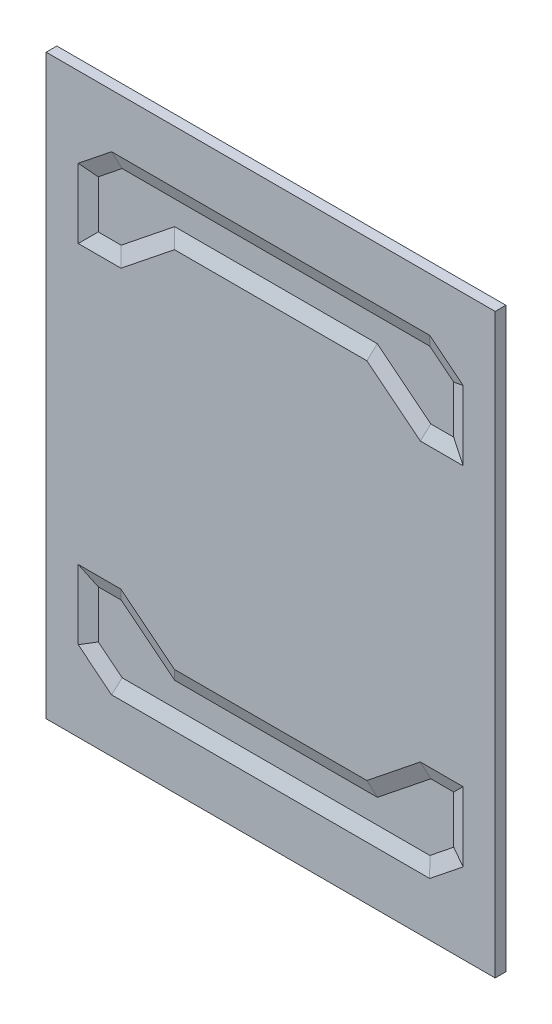
from build123d import *
from OCP.BRepFilletAPI import BRepFilletAPI_MakeChamfer

# Parameters (mm, degrees)
ESQUISSE1_W             = 420
ESQUISSE1_H             = 540
BOSS_EXTRU_1_DEPTH      = 10
ENL_V_MAT_EXTRU_1_DEPTH = 5
CHANFREIN1_SIZE         = 5
CHANFREIN1_SIZE_2       = 13.737387097


with BuildPart() as part:
    # Esquisse1 → Boss.-Extru.1 (new body)
    with BuildSketch(Plane.XY):
        with Locations((210, 270)):
            Rectangle(ESQUISSE1_W, ESQUISSE1_H)
    extrude(amount=BOSS_EXTRU_1_DEPTH)

    # Esquisse2 → Enlèv. mat.-Extru.1 (cut)
    with BuildSketch(Plane.XY.offset(10)):
        Polygon((300, 100), (120, 100), (70, 140), (30, 140), (30, 75), (61.25, 50), (358.75, 50), (390, 75), (390, 140), (350, 140), align=None)
        Polygon((30, 465), (61.25, 490), (358.75, 490), (390, 465), (390, 400), (350, 400), (300, 440), (120, 440), (70, 400), (30, 400), align=None)
    extrude(amount=-ENL_V_MAT_EXTRU_1_DEPTH, mode=Mode.SUBTRACT)

    # Chanfrein1
    chanfrein1_edges_1 = [part.edges().sort_by_distance(p)[0] for p in [
        (390, 107.5, 5),
    ]]
    chanfrein1_side_1 = [part.faces().sort_by_distance(p)[0] for p in [
        (390, 107.5, 5.1),
    ]]
    chanfrein1_edges_2 = [part.edges().sort_by_distance(p)[0] for p in [
        (374.375, 62.5, 5),
    ]]
    chanfrein1_side_2 = [part.faces().sort_by_distance(p)[0] for p in [
        (374.375, 62.5, 5.1),
    ]]
    chanfrein1_edges_3 = [part.edges().sort_by_distance(p)[0] for p in [
        (210, 50, 5),
    ]]
    chanfrein1_side_3 = [part.faces().sort_by_distance(p)[0] for p in [
        (210, 50, 5.1),
    ]]
    chanfrein1_edges_4 = [part.edges().sort_by_distance(p)[0] for p in [
        (45.625, 62.5, 5),
    ]]
    chanfrein1_side_4 = [part.faces().sort_by_distance(p)[0] for p in [
        (45.625, 62.5, 5.1),
    ]]
    chanfrein1_edges_5 = [part.edges().sort_by_distance(p)[0] for p in [
        (30, 107.5, 5),
    ]]
    chanfrein1_side_5 = [part.faces().sort_by_distance(p)[0] for p in [
        (30, 107.5, 5.1),
    ]]
    chanfrein1_edges_6 = [part.edges().sort_by_distance(p)[0] for p in [
        (50, 140, 5),
    ]]
    chanfrein1_side_6 = [part.faces().sort_by_distance(p)[0] for p in [
        (50, 140, 5.1),
    ]]
    chanfrein1_edges_7 = [part.edges().sort_by_distance(p)[0] for p in [
        (95, 120, 5),
    ]]
    chanfrein1_side_7 = [part.faces().sort_by_distance(p)[0] for p in [
        (95, 120, 5.1),
    ]]
    chanfrein1_edges_8 = [part.edges().sort_by_distance(p)[0] for p in [
        (210, 100, 5),
    ]]
    chanfrein1_side_8 = [part.faces().sort_by_distance(p)[0] for p in [
        (210, 100, 5.1),
    ]]
    chanfrein1_edges_9 = [part.edges().sort_by_distance(p)[0] for p in [
        (325, 120, 5),
    ]]
    chanfrein1_side_9 = [part.faces().sort_by_distance(p)[0] for p in [
        (325, 120, 5.1),
    ]]
    chanfrein1_edges_10 = [part.edges().sort_by_distance(p)[0] for p in [
        (370, 140, 5),
    ]]
    chanfrein1_side_10 = [part.faces().sort_by_distance(p)[0] for p in [
        (370, 140, 5.1),
    ]]
    chanfrein1_edges_11 = [part.edges().sort_by_distance(p)[0] for p in [
        (45.625, 477.5, 5),
    ]]
    chanfrein1_side_11 = [part.faces().sort_by_distance(p)[0] for p in [
        (45.625, 477.5, 5.1),
    ]]
    chanfrein1_edges_12 = [part.edges().sort_by_distance(p)[0] for p in [
        (210, 490, 5),
    ]]
    chanfrein1_side_12 = [part.faces().sort_by_distance(p)[0] for p in [
        (210, 490, 5.1),
    ]]
    chanfrein1_edges_13 = [part.edges().sort_by_distance(p)[0] for p in [
        (374.375, 477.5, 5),
    ]]
    chanfrein1_side_13 = [part.faces().sort_by_distance(p)[0] for p in [
        (374.375, 477.5, 5.1),
    ]]
    chanfrein1_edges_14 = [part.edges().sort_by_distance(p)[0] for p in [
        (390, 432.5, 5),
    ]]
    chanfrein1_side_14 = [part.faces().sort_by_distance(p)[0] for p in [
        (390, 432.5, 5.1),
    ]]
    chanfrein1_edges_15 = [part.edges().sort_by_distance(p)[0] for p in [
        (370, 400, 5),
    ]]
    chanfrein1_side_15 = [part.faces().sort_by_distance(p)[0] for p in [
        (370, 400, 5.1),
    ]]
    chanfrein1_edges_16 = [part.edges().sort_by_distance(p)[0] for p in [
        (325, 420, 5),
    ]]
    chanfrein1_side_16 = [part.faces().sort_by_distance(p)[0] for p in [
        (325, 420, 5.1),
    ]]
    chanfrein1_edges_17 = [part.edges().sort_by_distance(p)[0] for p in [
        (210, 440, 5),
    ]]
    chanfrein1_side_17 = [part.faces().sort_by_distance(p)[0] for p in [
        (210, 440, 5.1),
    ]]
    chanfrein1_edges_18 = [part.edges().sort_by_distance(p)[0] for p in [
        (95, 420, 5),
    ]]
    chanfrein1_side_18 = [part.faces().sort_by_distance(p)[0] for p in [
        (95, 420, 5.1),
    ]]
    chanfrein1_edges_19 = [part.edges().sort_by_distance(p)[0] for p in [
        (50, 400, 5),
    ]]
    chanfrein1_side_19 = [part.faces().sort_by_distance(p)[0] for p in [
        (50, 400, 5.1),
    ]]
    chanfrein1_edges_20 = [part.edges().sort_by_distance(p)[0] for p in [
        (30, 432.5, 5),
    ]]
    chanfrein1_side_20 = [part.faces().sort_by_distance(p)[0] for p in [
        (30, 432.5, 5.1),
    ]]
    chanfrein1 = BRepFilletAPI_MakeChamfer(part.part.solid().wrapped)
    for e in chanfrein1_edges_1:
        chanfrein1.Add(CHANFREIN1_SIZE - 0.0001, CHANFREIN1_SIZE_2 - 0.0001, e.wrapped, chanfrein1_side_1[0].wrapped)
    for e in chanfrein1_edges_2:
        chanfrein1.Add(CHANFREIN1_SIZE - 0.0001, CHANFREIN1_SIZE_2 - 0.0001, e.wrapped, chanfrein1_side_2[0].wrapped)
    for e in chanfrein1_edges_3:
        chanfrein1.Add(CHANFREIN1_SIZE - 0.0001, CHANFREIN1_SIZE_2 - 0.0001, e.wrapped, chanfrein1_side_3[0].wrapped)
    for e in chanfrein1_edges_4:
        chanfrein1.Add(CHANFREIN1_SIZE - 0.0001, CHANFREIN1_SIZE_2 - 0.0001, e.wrapped, chanfrein1_side_4[0].wrapped)
    for e in chanfrein1_edges_5:
        chanfrein1.Add(CHANFREIN1_SIZE - 0.0001, CHANFREIN1_SIZE_2 - 0.0001, e.wrapped, chanfrein1_side_5[0].wrapped)
    for e in chanfrein1_edges_6:
        chanfrein1.Add(CHANFREIN1_SIZE - 0.0001, CHANFREIN1_SIZE_2 - 0.0001, e.wrapped, chanfrein1_side_6[0].wrapped)
    for e in chanfrein1_edges_7:
        chanfrein1.Add(CHANFREIN1_SIZE - 0.0001, CHANFREIN1_SIZE_2 - 0.0001, e.wrapped, chanfrein1_side_7[0].wrapped)
    for e in chanfrein1_edges_8:
        chanfrein1.Add(CHANFREIN1_SIZE - 0.0001, CHANFREIN1_SIZE_2 - 0.0001, e.wrapped, chanfrein1_side_8[0].wrapped)
    for e in chanfrein1_edges_9:
        chanfrein1.Add(CHANFREIN1_SIZE - 0.0001, CHANFREIN1_SIZE_2 - 0.0001, e.wrapped, chanfrein1_side_9[0].wrapped)
    for e in chanfrein1_edges_10:
        chanfrein1.Add(CHANFREIN1_SIZE - 0.0001, CHANFREIN1_SIZE_2 - 0.0001, e.wrapped, chanfrein1_side_10[0].wrapped)
    for e in chanfrein1_edges_11:
        chanfrein1.Add(CHANFREIN1_SIZE - 0.0001, CHANFREIN1_SIZE_2 - 0.0001, e.wrapped, chanfrein1_side_11[0].wrapped)
    for e in chanfrein1_edges_12:
        chanfrein1.Add(CHANFREIN1_SIZE - 0.0001, CHANFREIN1_SIZE_2 - 0.0001, e.wrapped, chanfrein1_side_12[0].wrapped)
    for e in chanfrein1_edges_13:
        chanfrein1.Add(CHANFREIN1_SIZE - 0.0001, CHANFREIN1_SIZE_2 - 0.0001, e.wrapped, chanfrein1_side_13[0].wrapped)
    for e in chanfrein1_edges_14:
        chanfrein1.Add(CHANFREIN1_SIZE - 0.0001, CHANFREIN1_SIZE_2 - 0.0001, e.wrapped, chanfrein1_side_14[0].wrapped)
    for e in chanfrein1_edges_15:
        chanfrein1.Add(CHANFREIN1_SIZE - 0.0001, CHANFREIN1_SIZE_2 - 0.0001, e.wrapped, chanfrein1_side_15[0].wrapped)
    for e in chanfrein1_edges_16:
        chanfrein1.Add(CHANFREIN1_SIZE - 0.0001, CHANFREIN1_SIZE_2 - 0.0001, e.wrapped, chanfrein1_side_16[0].wrapped)
    for e in chanfrein1_edges_17:
        chanfrein1.Add(CHANFREIN1_SIZE - 0.0001, CHANFREIN1_SIZE_2 - 0.0001, e.wrapped, chanfrein1_side_17[0].wrapped)
    for e in chanfrein1_edges_18:
        chanfrein1.Add(CHANFREIN1_SIZE - 0.0001, CHANFREIN1_SIZE_2 - 0.0001, e.wrapped, chanfrein1_side_18[0].wrapped)
    for e in chanfrein1_edges_19:
        chanfrein1.Add(CHANFREIN1_SIZE - 0.0001, CHANFREIN1_SIZE_2 - 0.0001, e.wrapped, chanfrein1_side_19[0].wrapped)
    for e in chanfrein1_edges_20:
        chanfrein1.Add(CHANFREIN1_SIZE - 0.0001, CHANFREIN1_SIZE_2 - 0.0001, e.wrapped, chanfrein1_side_20[0].wrapped)
    add(Compound.cast(chanfrein1.Shape()), mode=Mode.REPLACE)  # a hair under: the kernel refuses the full size


solid = part.part
